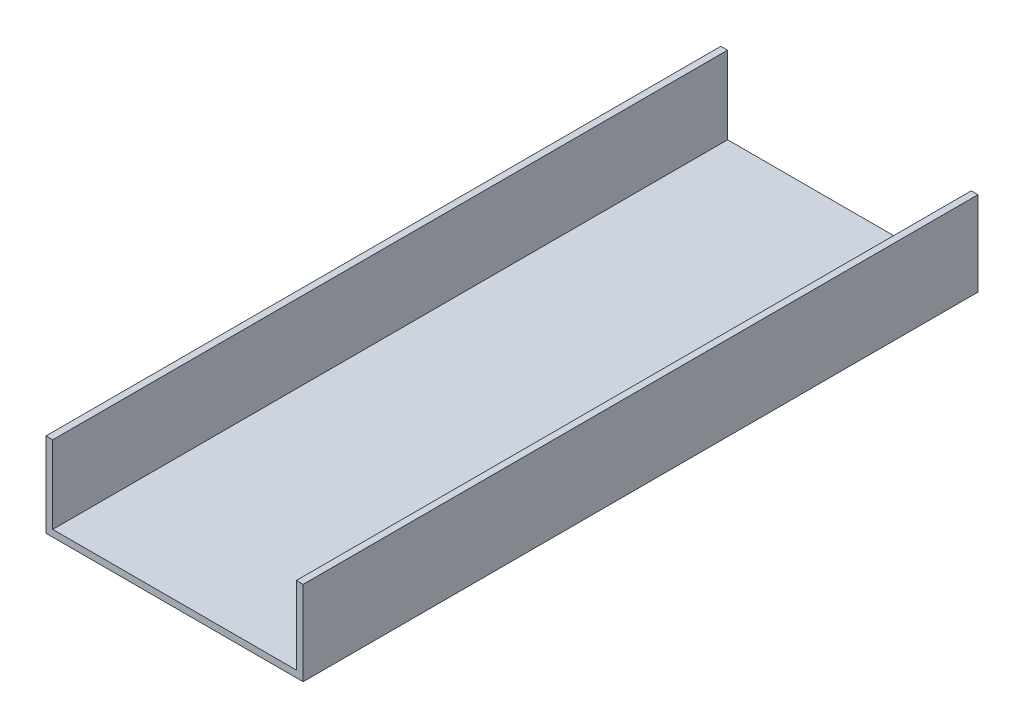
from build123d import *

# Parameters (mm, degrees)
SALIENTE_EXTRUIR1_DEPTH = 100


with BuildPart() as part:
    # Croquis1 → Saliente-Extruir1 (new, symmetric)
    with BuildSketch(Plane.XY):
        Polygon((-36.1, 12.5), (-38.1, 12.5), (-38.1, -12.5), (38.1, -12.5), (38.1, 12.5), (36.1, 12.5), (36.1, -10.5), (-36.1, -10.5), align=None)
    extrude(amount=SALIENTE_EXTRUIR1_DEPTH, both=True)


solid = part.part
